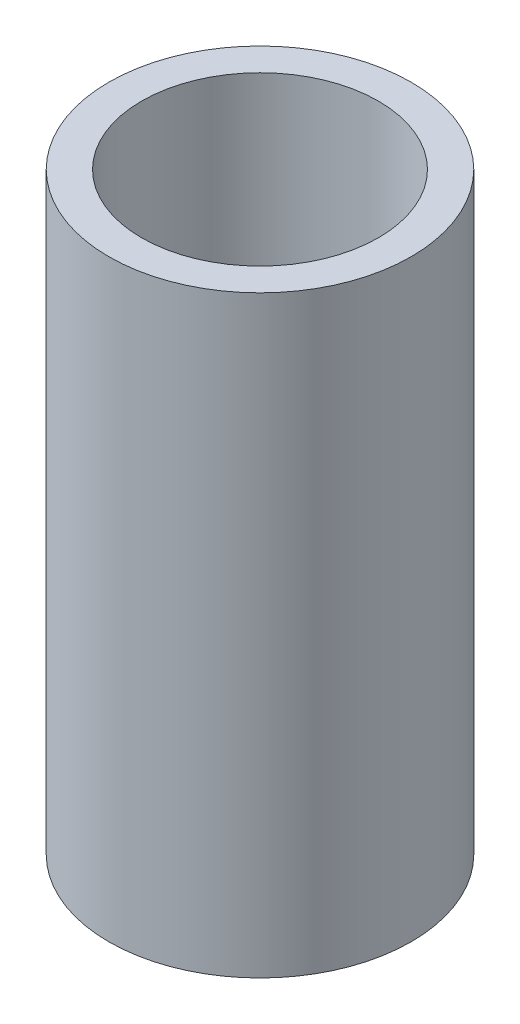
from build123d import *

# Parameters (mm, degrees)
SKETCH1_R           = 17.5
BOSS_EXTRUDE1_DEPTH = 68.691420647
SKETCH2_R           = 13.710323843
CUT_EXTRUDE1_DEPTH  = 74.013774526


with BuildPart() as part:
    # Sketch1 → Boss-Extrude1 (new body)
    with BuildSketch(Plane(origin=(0, 0, 0), x_dir=(1, 0, 0), z_dir=(0, 1, 0))):
        Circle(SKETCH1_R)
    extrude(amount=BOSS_EXTRUDE1_DEPTH)

    # Sketch2 → Cut-Extrude1 (cut, through all)
    with BuildSketch(Plane(origin=(0, 0, 0), x_dir=(1, 0, 0), z_dir=(0, 1, 0))):
        Circle(SKETCH2_R)
    extrude(amount=CUT_EXTRUDE1_DEPTH, mode=Mode.SUBTRACT)


solid = part.part
